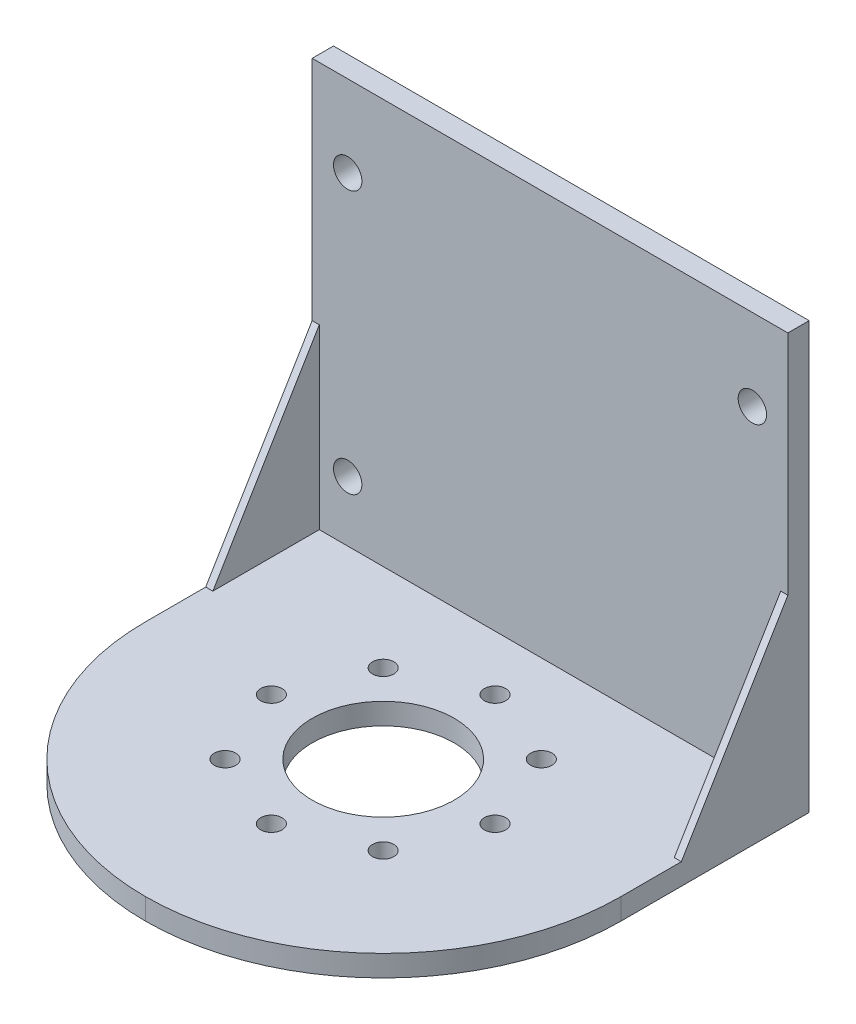
from build123d import *

# Parameters (mm, degrees)
SKETCH1_W           = 67
SKETCH1_H           = 60
SKETCH1_R           = 2
BOSS_EXTRUDE1_DEPTH = 3
SKETCH2_W           = 67
SKETCH2_H           = 3
BOSS_EXTRUDE2_DEPTH = 57
FILLET1_R           = 33.5
SKETCH3_R           = 10
SKETCH3_R_2         = 1.5
CUT_EXTRUDE1_DEPTH  = 57
BOSS_EXTRUDE3_DEPTH = 1
BOSS_EXTRUDE4_START = -66
BOSS_EXTRUDE4_DEPTH = 1


with BuildPart() as part:
    # Sketch1 → Boss-Extrude1 (new body)
    with BuildSketch(Plane.XY):
        Rectangle(SKETCH1_W, SKETCH1_H)
        with Locations((-28.5, 18.516649199)):
            Circle(SKETCH1_R, mode=Mode.SUBTRACT)
        with Locations(Location((28.5, 18.516649199, 0), (0, 0, 180))):
            Circle(SKETCH1_R, mode=Mode.SUBTRACT)
        with Locations((28.5, -18.516649199)):
            Circle(SKETCH1_R, mode=Mode.SUBTRACT)
        with Locations(Location((-28.5, -18.516649199, 0), (0, 0, 180))):
            Circle(SKETCH1_R, mode=Mode.SUBTRACT)
    extrude(amount=BOSS_EXTRUDE1_DEPTH)

    # Sketch2 → Boss-Extrude2 (add)
    with BuildSketch(Plane.XY.offset(3)):
        with Locations((0, -28.5)):
            Rectangle(SKETCH2_W, SKETCH2_H)
    extrude(amount=BOSS_EXTRUDE2_DEPTH)

    # Fillet1
    fillet1_edges = [part.edges().sort_by_distance(p)[0] for p in [
        (-33.5, -28.5, 60),
        (33.5, -28.5, 60),
    ]]
    fillet(fillet1_edges, radius=FILLET1_R - 0.0001)  # a hair under: the kernel refuses the full size

    # Sketch3 → Cut-Extrude1 (cut)
    with BuildSketch(Plane.XZ.offset(30)):
        with Locations(Location((0, 26.5, 0), (0, 0, 270))):
            Circle(SKETCH3_R)
        with Locations(Location((0, 42.252397405, 0), (0, 0, 270))):
            Circle(SKETCH3_R_2)
        with Locations(Location((11.138627025, 37.638627025, 0), (0, 0, 270))):
            Circle(SKETCH3_R_2)
        with Locations(Location((15.752397405, 26.5, 0), (0, 0, 270))):
            Circle(SKETCH3_R_2)
        with Locations(Location((11.138627025, 15.361372975, 0), (0, 0, 270))):
            Circle(SKETCH3_R_2)
        with Locations(Location((0, 10.747602595, 0), (0, 0, 270))):
            Circle(SKETCH3_R_2)
        with Locations(Location((-11.138627025, 15.361372975, 0), (0, 0, 270))):
            Circle(SKETCH3_R_2)
        with Locations(Location((-15.752397405, 26.5, 0), (0, 0, 270))):
            Circle(SKETCH3_R_2)
        with Locations(Location((-11.138627025, 37.638627025, 0), (0, 0, 270))):
            Circle(SKETCH3_R_2)
    extrude(amount=-CUT_EXTRUDE1_DEPTH, mode=Mode.SUBTRACT)

    # Sketch4 → Boss-Extrude3 (add)
    with BuildSketch(Plane.ZY.offset(33.5)):
        Polygon((3, -2), (18, -27), (3, -27), align=None)
    extrude(amount=-BOSS_EXTRUDE3_DEPTH)

    # Sketch4<2> → Boss-Extrude4 (add)
    with BuildSketch(Plane.ZY.offset(33.5).offset(BOSS_EXTRUDE4_START)):
        Polygon((3, -2), (18, -27), (3, -27), align=None)
    extrude(amount=-BOSS_EXTRUDE4_DEPTH)


solid = part.part
